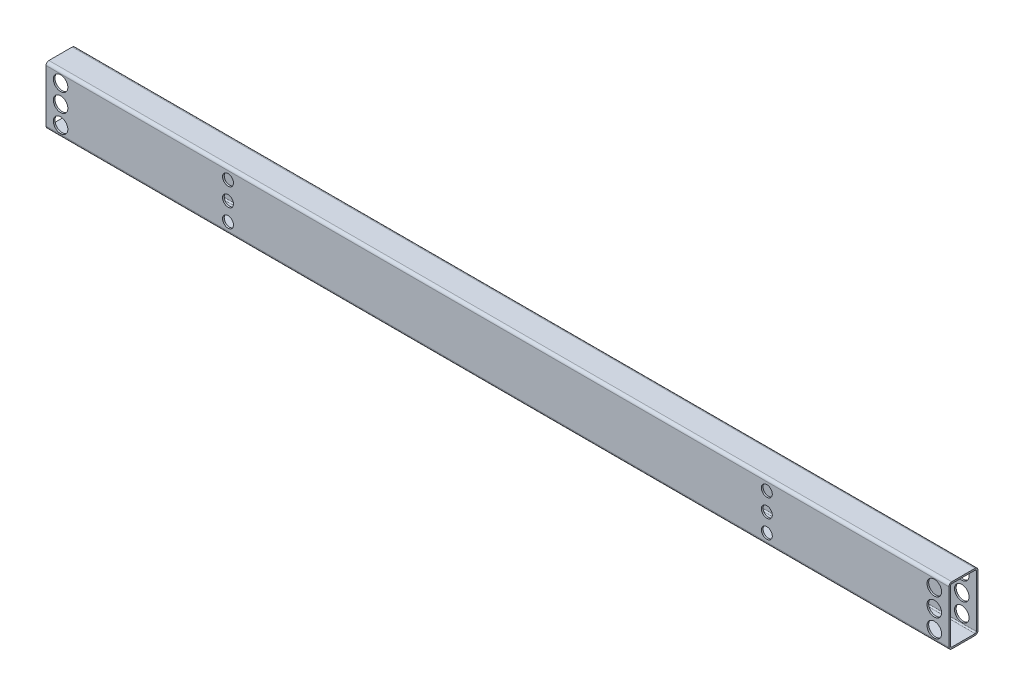
from build123d import *

# Parameters (mm, degrees)
EXTRUDE_THIN1_DEPTH          = 393.7
F_1_2_0_5_DIAMETER_HOLE1_D   = 12.7
F_3_8_0_375_DIAMETER_HOLE1_D = 9.525
CUT_EXTRUDE1_DEPTH           = 9.525


with BuildPart() as part:
    # Sketch1 → Extrude-Thin1 (new, symmetric)
    with BuildSketch(Plane(origin=(0, 0, 0), x_dir=(0, 0, -1), z_dir=(1, 0, 0))):
        with BuildLine():
            Line((-10.16, 25.4), (10.16, 25.4))
            ThreePointArc((10.16, 25.4), (11.956051224, 24.656051224), (12.7, 22.86))
            Line((12.7, 22.86), (12.7, -22.86))
            ThreePointArc((12.7, -22.86), (11.956051224, -24.656051224), (10.16, -25.4))
            Line((10.16, -25.4), (-10.16, -25.4))
            ThreePointArc((-10.16, -25.4), (-11.956051224, -24.656051224), (-12.7, -22.86))
            Line((-12.7, -22.86), (-12.7, 22.86))
            ThreePointArc((-12.7, 22.86), (-11.956051224, 24.656051224), (-10.16, 25.4))
        make_face()
        with BuildLine():
            Line((-10.16, 23.9522), (10.16, 23.9522))
            ThreePointArc((10.16, 23.9522), (10.932302026, 23.632302026), (11.2522, 22.86))
            Line((11.2522, 22.86), (11.2522, -22.86))
            ThreePointArc((11.2522, -22.86), (10.932302026, -23.632302026), (10.16, -23.9522))
            Line((10.16, -23.9522), (-10.16, -23.9522))
            ThreePointArc((-10.16, -23.9522), (-10.932302026, -23.632302026), (-11.2522, -22.86))
            Line((-11.2522, -22.86), (-11.2522, 22.86))
            ThreePointArc((-11.2522, 22.86), (-10.932302026, 23.632302026), (-10.16, 23.9522))
        make_face(mode=Mode.SUBTRACT)
    extrude(amount=EXTRUDE_THIN1_DEPTH, both=True)

    # 1/2 (0.5) Diameter Hole1 (through all)
    with Locations(Plane(origin=(0, 0, -12.7), x_dir=(-1, 0, 0), z_dir=(0, 0, -1))):
        with Locations((-381, 15.875), (-381, -15.875), (-381, 0), (381, -15.875), (381, 0), (381, 15.875)):
            Hole(F_1_2_0_5_DIAMETER_HOLE1_D / 2)

    # 3/8 (0.375) Diameter Hole1 (through all)
    with Locations(Plane(origin=(0, 0, -12.7), x_dir=(-1, 0, 0), z_dir=(0, 0, -1))):
        with Locations((-234.95, 15.875), (-234.95, 0), (-234.95, -15.875), (234.95, -15.875), (234.95, 0), (234.95, 15.875)):
            Hole(F_3_8_0_375_DIAMETER_HOLE1_D / 2)

    # Sketch6 → Cut-Extrude1 (cut)
    with BuildSketch(Plane(origin=(0, 0, -12.7), x_dir=(-1, 0, 0), z_dir=(0, 0, -1))):
        with BuildLine():
            Line((-120.65, -25.4), (-107.95, -25.4))
            Line((-107.95, -25.4), (-107.95, 15.875))
            ThreePointArc((-107.95, 15.875), (-108.87993597, 18.12006403), (-111.125, 19.05))
            Line((-111.125, 19.05), (-117.475, 19.05))
            ThreePointArc((-117.475, 19.05), (-119.72006403, 18.12006403), (-120.65, 15.875))
            Line((-120.65, 15.875), (-120.65, -25.4))
        make_face()
        with BuildLine():
            Line((-44.45, -25.4), (-31.75, -25.4))
            Line((-31.75, -25.4), (-31.75, 15.875))
            ThreePointArc((-31.75, 15.875), (-32.67993597, 18.12006403), (-34.925, 19.05))
            Line((-34.925, 19.05), (-41.275, 19.05))
            ThreePointArc((-41.275, 19.05), (-43.52006403, 18.12006403), (-44.45, 15.875))
            Line((-44.45, 15.875), (-44.45, -25.4))
        make_face()
        with BuildLine():
            Line((31.75, -25.4), (44.45, -25.4))
            Line((44.45, -25.4), (44.45, 15.875))
            ThreePointArc((44.45, 15.875), (43.52006403, 18.12006403), (41.275, 19.05))
            Line((41.275, 19.05), (34.925, 19.05))
            ThreePointArc((34.925, 19.05), (32.67993597, 18.12006403), (31.75, 15.875))
            Line((31.75, 15.875), (31.75, -25.4))
        make_face()
        with BuildLine():
            Line((107.95, -25.4), (120.65, -25.4))
            Line((120.65, -25.4), (120.65, 15.875))
            ThreePointArc((120.65, 15.875), (119.72006403, 18.12006403), (117.475, 19.05))
            Line((117.475, 19.05), (111.125, 19.05))
            ThreePointArc((111.125, 19.05), (108.87993597, 18.12006403), (107.95, 15.875))
            Line((107.95, 15.875), (107.95, -25.4))
        make_face()
    extrude(amount=-CUT_EXTRUDE1_DEPTH, mode=Mode.SUBTRACT)


solid = part.part
